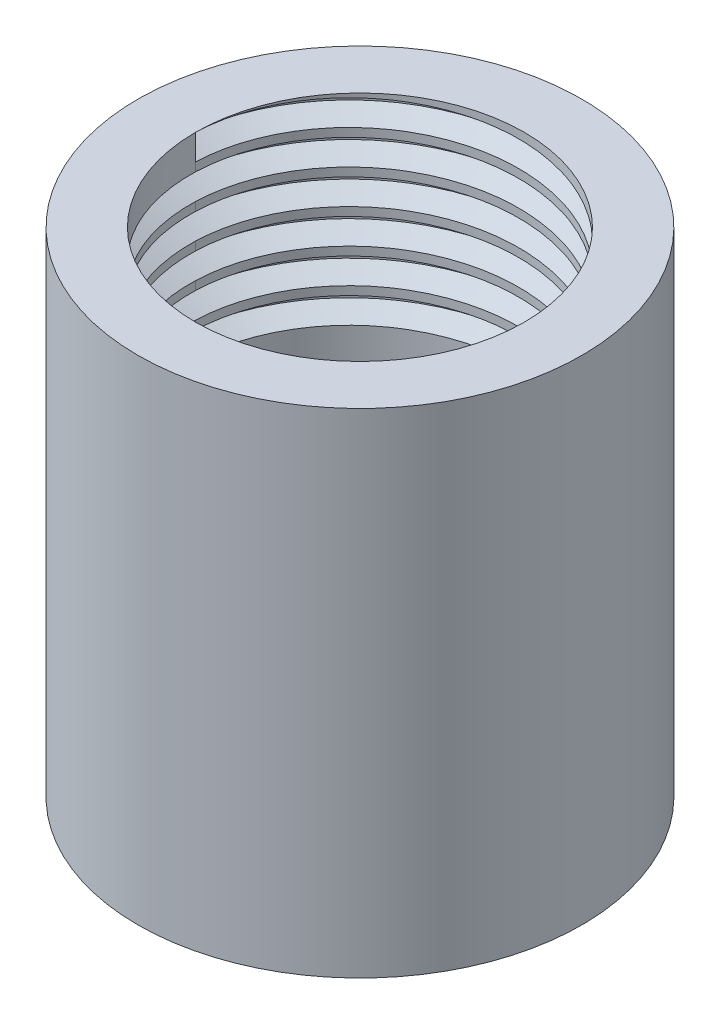
from build123d import *

# Parameters (mm, degrees)
SKETCH1_R               = 13.716
SKETCH1_R_2             = 10.16
SKETCH1_R_3             = 2.54
BOSS_EXTRUDE3_DEPTH     = 5.08
SKETCH1_9_R             = 13.716
SKETCH1_9_R_2           = 10.16
BOSS_EXTRUDE4_DEPTH     = 30.48
THREAD1_PITCH           = 2.116666667
SKETCH15_R              = 2.54
BOSS_EXTRUDE5_DEPTH     = 5.08
F_1_4_20_TAPPED_HOLE1_D = 5.1054


with BuildPart() as part:
    # Sketch1 → Boss-Extrude3 (new body)
    # profile 1 of 2: a face of its own
    with BuildSketch(Plane(origin=(0, 0, 0), x_dir=(1, 0, 0), z_dir=(0, 1, 0))):
        with Locations(Location((0, 0, 0), (0, 0, 270))):
            Circle(SKETCH1_R)
        Circle(SKETCH1_R_2, mode=Mode.SUBTRACT)
    # profile 2 of 2: a face of its own
    with BuildSketch(Plane(origin=(0, 0, 0), x_dir=(1, 0, 0), z_dir=(0, 1, 0))):
        Circle(SKETCH1_R_2)
        with Locations(Location((6.35, 0, 0), (0, 0, 270))):
            Circle(SKETCH1_R_3, mode=Mode.SUBTRACT)
        with Locations(Location((0, 0, 0), (0, 0, 270))):
            Circle(SKETCH1_R_3, mode=Mode.SUBTRACT)
    extrude(amount=BOSS_EXTRUDE3_DEPTH)

    # Sketch1<9> → Boss-Extrude4 (add)
    with BuildSketch(Plane(origin=(0, 0, 0), x_dir=(1, 0, 0), z_dir=(0, 1, 0))):
        with Locations(Location((0, 0, 0), (0, 0, 270))):
            Circle(SKETCH1_9_R)
        with Locations(Location((0, 0, 0), (0, 0, 90))):
            Circle(SKETCH1_9_R_2, mode=Mode.SUBTRACT)
    extrude(amount=BOSS_EXTRUDE4_DEPTH)

    # Thread1: the profile of Thread Profile2 profile screwed along a right-hand helix of 6 turns, 10 arcs to a turn; built about Z, then put on its axis
    thread1_z = Axis((0, 0, 0), (0, 0, 1))
    thread1_corners = [(10.1597, 0, -0.000173205), (11.305679435, 0, 0.66145833), (11.305679435, 0, 0.926041664), (10.1597, 0, 1.587673199)]
    with BuildLine(mode=Mode.PRIVATE) as thread1_profile:
        Line(thread1_corners[0], thread1_corners[1])
        Line(thread1_corners[1], thread1_corners[2])
        Line(thread1_corners[2], thread1_corners[3])
        Line(thread1_corners[3], thread1_corners[0])
    thread1_cap = Face(thread1_profile.wire())
    thread1_turn_angles = [0, 18, 36, 54, 72, 90, 108, 126, 144, 162, 180, 198, 216, 234, 252, 270, 288, 306, 324, 342, 360]
    thread1_turn_weights = [1, 0.9510565162951535, 1, 0.9510565162951535, 1, 0.9510565162951535, 1, 0.9510565162951535, 1, 0.9510565162951535, 1, 0.9510565162951535, 1, 0.9510565162951535, 1, 0.9510565162951535, 1, 0.9510565162951535, 1, 0.9510565162951535, 1]
    thread1_turn_rails = [Edge.make_bspline([Vector(p[0], p[1], 0).rotate(thread1_z, thread1_turn_angles[k]) / thread1_turn_weights[k] + Vector(0, 0, p[2] + THREAD1_PITCH * thread1_turn_angles[k] / 360) for k in range(21)], [0, 0, 0, 1, 1, 2, 2, 3, 3, 4, 4, 5, 5, 6, 6, 7, 7, 8, 8, 9, 9, 10, 10, 10], 2, thread1_turn_weights) for p in thread1_corners]
    thread1_turn_sides = [Face.make_surface_from_curves(thread1_turn_rails[p[0]], thread1_turn_rails[p[1]]) for p in [(0, 1), (1, 2), (2, 3), (3, 0)]]
    thread1 = Plane(origin=(0, 30.48, 0), x_dir=(-1, 0, 0), z_dir=(0, -1, 0)) * Solid(Shell([*[p.moved(Location((0, 0, THREAD1_PITCH * i))) for i in range(6) for p in thread1_turn_sides], thread1_cap, thread1_cap.rotate(thread1_z, 2160).moved(Location((0, 0, THREAD1_PITCH * 2160 / 360)))]))
    add(thread1, mode=Mode.SUBTRACT)

    # Sketch15 → Boss-Extrude5 (add, through all)
    with BuildSketch(Plane(origin=(0, 5.08, 0), x_dir=(1, 0, 0), z_dir=(0, 1, 0))):
        Circle(SKETCH15_R)
    extrude(amount=-BOSS_EXTRUDE5_DEPTH)

    # 1/4-20 Tapped Hole1 (through all)
    with Locations(Plane(origin=(0, 5.08, 0), x_dir=(1, 0, 0), z_dir=(0, 1, 0))):
        with Locations((0, 0)):
            Hole(F_1_4_20_TAPPED_HOLE1_D / 2)


solid = part.part
